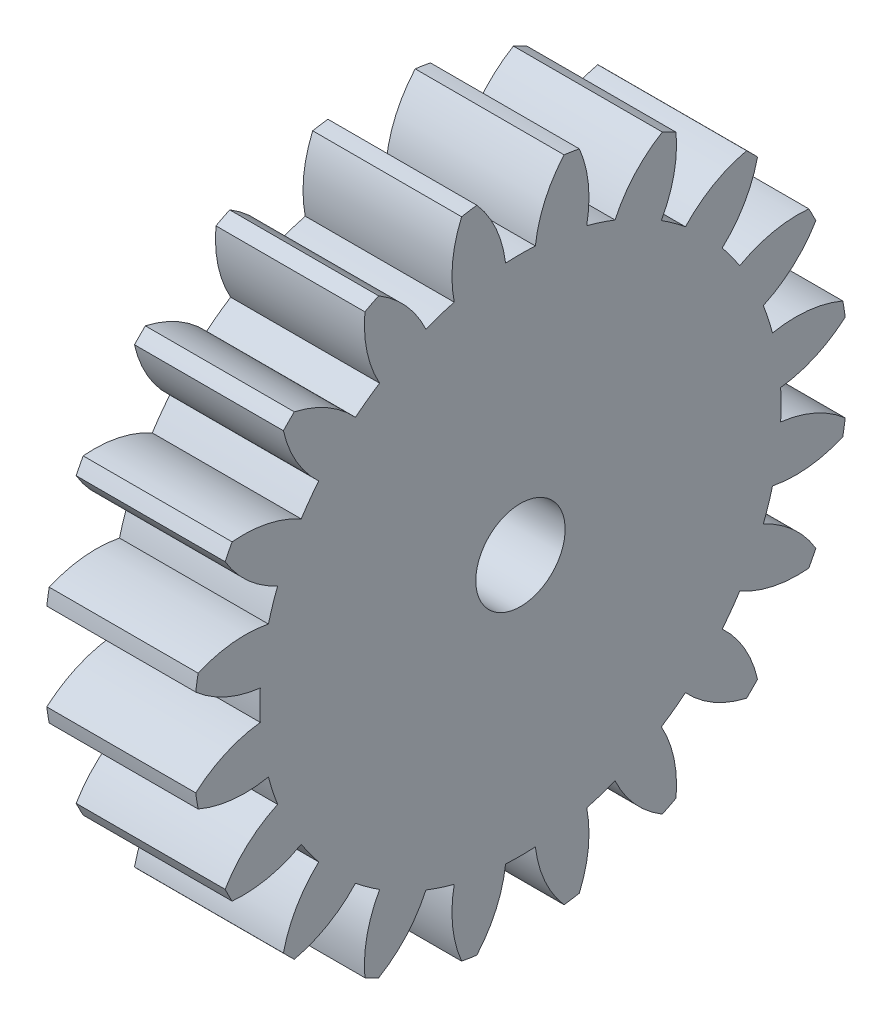
from build123d import *

# Parameters (mm, degrees)
BASPROSKE_W     = 5
BASPROSKE_H     = 11
TOOTHCUT_DEPTH  = 17.340134638
TEETHCUTS_COUNT = 20
TEETHCUTS_ANGLE = 342
BORSKE_R        = 1.5
BORE_DEPTH      = 50.0000508


with BuildPart() as part:
    # BasProSke → Base-Revolve (revolve)
    with BuildSketch(Plane(origin=(0, 0, 0), x_dir=(1, 0, 0), z_dir=(0, 1, 0))):
        with Locations((2.5, 5.5)):
            Rectangle(BASPROSKE_W, BASPROSKE_H)
    revolve(axis=Axis((-10, 0, 0), (1, 0, 0)))

    # TooCutSke → ToothCut (cut, through all)
    with BuildSketch(Plane(origin=(0, 0, 0), x_dir=(0, 0, -1), z_dir=(1, 0, 0))):
        with BuildLine():
            ThreePointArc((0.499924007, 8.734705318), (0, 8.749), (-0.499924007, 8.734705318))
            ThreePointArc((-0.499924007, 8.734705318), (-0.824302243, 9.905497836), (-1.485192705, 10.924909509))
            ThreePointArc((-1.485192705, 10.924909509), (0, 11.0254), (1.485192705, 10.924909509))
            ThreePointArc((1.485192705, 10.924909509), (0.824302243, 9.905497836), (0.499924007, 8.734705318))
        make_face()
    toothcut = extrude(amount=TOOTHCUT_DEPTH, mode=Mode.SUBTRACT)

    # TeethCuts: ToothCut ×20 about axis
    teethcuts_axis = Axis((-10, 0, 0), (1, 0, 0))
    for i in range(1, TEETHCUTS_COUNT):
        add(toothcut.rotate(teethcuts_axis, i * TEETHCUTS_ANGLE / (TEETHCUTS_COUNT - 1)), mode=Mode.SUBTRACT)

    # BorSke → Bore (cut, symmetric)
    with BuildSketch(Plane(origin=(0, 0, 0), x_dir=(0, 0, -1), z_dir=(1, 0, 0))):
        Circle(BORSKE_R)
    extrude(amount=BORE_DEPTH, both=True, mode=Mode.SUBTRACT)


solid = part.part
